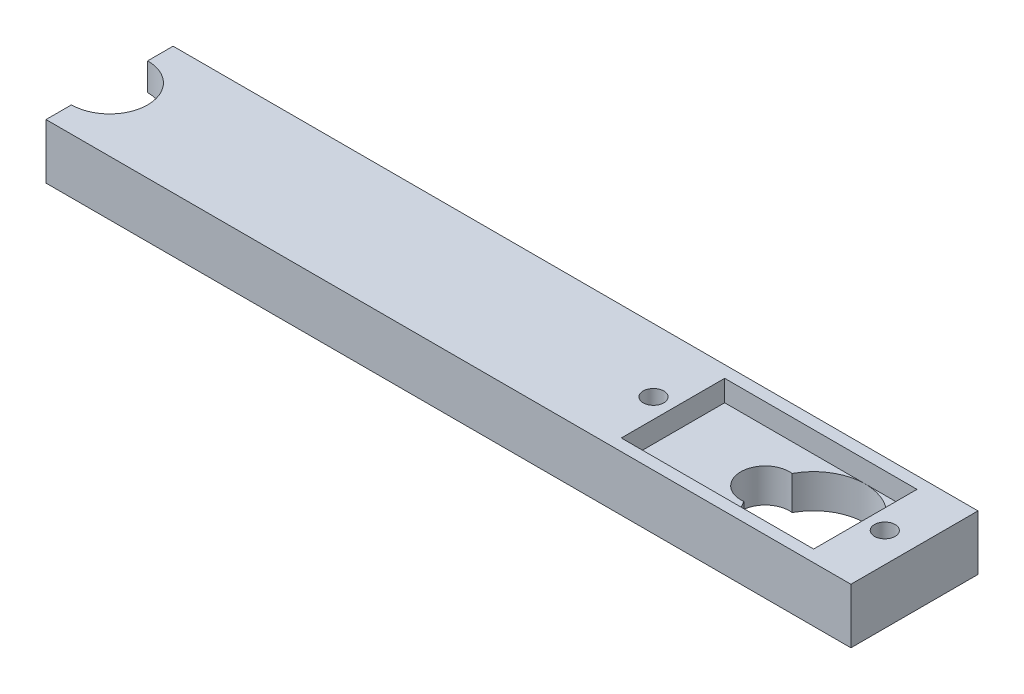
from build123d import *

# Parameters (mm, degrees)
SKETCH2_W                   = 95
SKETCH2_H                   = 15
BOSS_EXTRUDE1_DEPTH         = 3.25
CAVITY1_START               = -2.5
CAVITY1_DEPTH               = 2.5
CAVITY1_START_2             = -1.5
CAVITY1_2_DEPTH             = 4.75
CAVITY1_3_DEPTH             = 1.5
CUT_EXTRUDE1_START          = -5.75
CUT_EXTRUDE1_DEPTH          = 5.75
CUT_EXTRUDE2_START          = -1
CUT_EXTRUDE2_DEPTH          = 1
F_41_0_096_DIAMETER_HOLE1_D = 2.4384
CUT_EXTRUDE4_DEPTH          = 2
CAVITY2_START               = -3.25
CAVITY2_DEPTH               = 6.5
CAVITY2_START_2             = 0.75
CAVITY2_2_DEPTH             = 2.5
SKETCH12_W                  = 22.7
SKETCH12_H                  = 12.2
SKETCH12_W_2                = 22.5
SKETCH12_H_2                = 12
CUT_EXTRUDE6_DEPTH          = 2.5
CUT_EXTRUDE7_START          = -4
CUT_EXTRUDE7_DEPTH          = 4
SKETCH15_W                  = 8.5
SKETCH15_H                  = 4.25
SKETCH15_W_2                = 5
SKETCH15_H_2                = 3.25
CUT_EXTRUDE8_DEPTH          = 1.125


# Read off the part's stored shape, not the designer's step: Cavity1, Cavity2
with BuildPart() as part:
    # Sketch2 → Boss-Extrude1 (new, symmetric)
    with BuildSketch(Plane(origin=(0, 0, 0), x_dir=(1, 0, 0), z_dir=(0, 1, 0))):
        Rectangle(SKETCH2_W, SKETCH2_H)
    extrude(amount=BOSS_EXTRUDE1_DEPTH, both=True)

    # Cavity1 outline → Cavity1 (cut)
    with BuildSketch(Plane(origin=(0, 0, 0), x_dir=(1, 0, 0), z_dir=(0, 1, 0)).offset(CAVITY1_START)):
        with BuildLine():
            ThreePointArc((-47.5, 2.875), (-44.625, 0), (-47.5, -2.875))
            Line((-47.5, -2.875), (-47.5, -3.425))
            ThreePointArc((-47.5, -3.425), (-44.075, 0), (-47.5, 3.425))
            Line((-47.5, 3.425), (-47.5, 2.875))
        make_face()
        with BuildLine():
            Line((-47.5, 6.25), (-47.5, 4.5))
            ThreePointArc((-47.5, 4.5), (-43, 0), (-47.5, -4.5))
            Line((-47.5, -4.5), (-47.5, -6.25))
            ThreePointArc((-47.5, -6.25), (-45.523576462, -5.929270613), (-43.75, -5))
            Line((-43.75, -5), (-30.438820488, -2.75))
            ThreePointArc((-30.438820488, -2.75), (-28.114646288, 0), (-30.438820488, 2.75))
            Line((-30.438820488, 2.75), (-43.75, 5))
            ThreePointArc((-43.75, 5), (-45.523576462, 5.929270613), (-47.5, 6.25))
        make_face()
    extrude(amount=CAVITY1_DEPTH, mode=Mode.SUBTRACT)

    # Cavity1 2 outline → Cavity1 2 (cut)
    with BuildSketch(Plane(origin=(0, 0, 0), x_dir=(1, 0, 0), z_dir=(0, 1, 0)).offset(CAVITY1_START_2)):
        with BuildLine():
            ThreePointArc((-47.5, 3), (-44.5, 0), (-47.5, -3))
            Line((-47.5, -3), (-47.5, -4.5))
            ThreePointArc((-47.5, -4.5), (-43, 0), (-47.5, 4.5))
            Line((-47.5, 4.5), (-47.5, 3))
        make_face()
    extrude(amount=CAVITY1_2_DEPTH, mode=Mode.SUBTRACT)

    # Cavity1 3 outline → Cavity1 3 (cut)
    with BuildSketch(Plane(origin=(0, 0, 0), x_dir=(1, 0, 0), z_dir=(0, 1, 0)).offset(CAVITY1_START_2)):
        with BuildLine():
            Line((-47.5, 2.875), (-47.5, 1.5))
            ThreePointArc((-47.5, 1.5), (-46, 0), (-47.5, -1.5))
            Line((-47.5, -1.5), (-47.5, -2.875))
            ThreePointArc((-47.5, -2.875), (-44.625, 0), (-47.5, 2.875))
        make_face()
    extrude(amount=CAVITY1_3_DEPTH, mode=Mode.SUBTRACT)

    # Sketch4 → Cut-Extrude1 (cut)
    with BuildSketch(Plane(origin=(0, 3.25, 0), x_dir=(1, 0, 0), z_dir=(0, 1, 0)).offset(CUT_EXTRUDE1_START)):
        with BuildLine():
            Line((-47.5, 3), (-47.5, -3))
            ThreePointArc((-47.5, -3), (-44.5, 0), (-47.5, 3))
        make_face()
    extrude(amount=CUT_EXTRUDE1_DEPTH, mode=Mode.SUBTRACT)

    # Sketch6 → Cut-Extrude2 (cut)
    with BuildSketch(Plane(origin=(0, -1.5, 0), x_dir=(1, 0, 0), z_dir=(0, 1, 0)).offset(CUT_EXTRUDE2_START)):
        with BuildLine():
            Line((-47.5, 4.5), (-47.5, 3.425))
            ThreePointArc((-47.5, 3.425), (-44.075, 0), (-47.5, -3.425))
            Line((-47.5, -3.425), (-47.5, -4.5))
            ThreePointArc((-47.5, -4.5), (-43, 0), (-47.5, 4.5))
        make_face()
    extrude(amount=CUT_EXTRUDE2_DEPTH, mode=Mode.SUBTRACT)

    # #41 (0.096) Diameter Hole1 (through all)
    with Locations(Plane(origin=(0, -3.25, 0), x_dir=(-1, 0, 0), z_dir=(0, -1, 0))):
        with Locations((-44, 0), (-16.7, 0)):
            Hole(F_41_0_096_DIAMETER_HOLE1_D / 2)

    # Sketch10 → Cut-Extrude4 (cut)
    with BuildSketch(Plane.XZ.offset(3.25)):
        Polygon((46.5, -1.443375673), (46.5, 1.443375673), (44, 2.886751346), (41.5, 1.443375673), (41.5, -1.443375673), (44, -2.886751346), align=None)
        Polygon((16.7, 2.886751346), (14.2, 1.443375673), (14.2, -1.443375673), (16.7, -2.886751346), (19.2, -1.443375673), (19.2, 1.443375673), align=None)
    extrude(amount=-CUT_EXTRUDE4_DEPTH, mode=Mode.SUBTRACT)

    # Cavity2 outline → Cavity2 (cut)
    with BuildSketch(Plane(origin=(0, 0, 0), x_dir=(1, 0, 0), z_dir=(0, 1, 0)).offset(CAVITY2_START)):
        with BuildLine():
            ThreePointArc((30.267317748, -2.75), (41.6, 0), (30.267317748, 2.75))
            ThreePointArc((30.267317748, 2.75), (27.1, 0), (30.267317748, -2.75))
        make_face()
    extrude(amount=CAVITY2_DEPTH, mode=Mode.SUBTRACT)

    # Cavity2 2 outline → Cavity2 2 (cut)
    with BuildSketch(Plane(origin=(0, 0, 0), x_dir=(1, 0, 0), z_dir=(0, 1, 0)).offset(CAVITY2_START_2)):
        with BuildLine():
            Line((19.1, 6), (19.1, -6))
            Line((19.1, -6), (35.6, -6))
            ThreePointArc((35.6, -6), (32.477501001, -5.123475383), (30.267317748, -2.75))
            ThreePointArc((30.267317748, -2.75), (27.1, 0), (30.267317748, 2.75))
            ThreePointArc((30.267317748, 2.75), (32.477501001, 5.123475383), (35.6, 6))
            Line((35.6, 6), (19.1, 6))
        make_face()
        with BuildLine():
            ThreePointArc((41.5, -1.090871211), (39.4376277, -4.61222437), (35.6, -6))
            Line((35.6, -6), (41.6, -6))
            Line((41.6, -6), (41.6, 0))
            ThreePointArc((41.6, 0), (41.574947699, -0.547722558), (41.5, -1.090871211))
        make_face()
        with BuildLine():
            Line((41.6, 6), (35.6, 6))
            ThreePointArc((35.6, 6), (39.4376277, 4.612224369), (41.5, 1.090871211))
            ThreePointArc((41.5, 1.090871211), (41.574947699, 0.547722558), (41.6, 0))
            Line((41.6, 0), (41.6, 6))
        make_face()
    extrude(amount=CAVITY2_2_DEPTH, mode=Mode.SUBTRACT)

    # Sketch12 → Cut-Extrude6 (cut)
    with BuildSketch(Plane(origin=(0, 0.75, 0), x_dir=(1, 0, 0), z_dir=(0, 1, 0))):
        with Locations((30.35, 0)):
            Rectangle(SKETCH12_W, SKETCH12_H)
        with Locations((30.35, 0)):
            Rectangle(SKETCH12_W_2, SKETCH12_H_2, mode=Mode.SUBTRACT)
    extrude(amount=CUT_EXTRUDE6_DEPTH, mode=Mode.SUBTRACT)

    # Sketch13 → Cut-Extrude7 (cut)
    with BuildSketch(Plane(origin=(0, 0.75, 0), x_dir=(1, 0, 0), z_dir=(0, 1, 0)).offset(CUT_EXTRUDE7_START)):
        with BuildLine():
            ThreePointArc((30.211004889, -2.858099316), (41.7, 0), (30.211004889, 2.858099316))
            ThreePointArc((30.211004889, 2.858099316), (27, 0), (30.211004889, -2.858099316))
        make_face()
        with BuildLine():
            ThreePointArc((30.267317748, 2.75), (41.6, 0), (30.267317748, -2.75))
            ThreePointArc((30.267317748, -2.75), (27.1, 0), (30.267317748, 2.75))
        make_face(mode=Mode.SUBTRACT)
    extrude(amount=CUT_EXTRUDE7_DEPTH, mode=Mode.SUBTRACT)

    # Sketch15 → Cut-Extrude8 (cut, symmetric)
    with BuildSketch(Plane.XY):
        with Locations((3.75, -1.125)):
            Rectangle(SKETCH15_W, SKETCH15_H)
        with Locations((-3, -0.625)):
            Rectangle(SKETCH15_W_2, SKETCH15_H_2)
    extrude(amount=CUT_EXTRUDE8_DEPTH, both=True, mode=Mode.SUBTRACT)


solid = part.part
